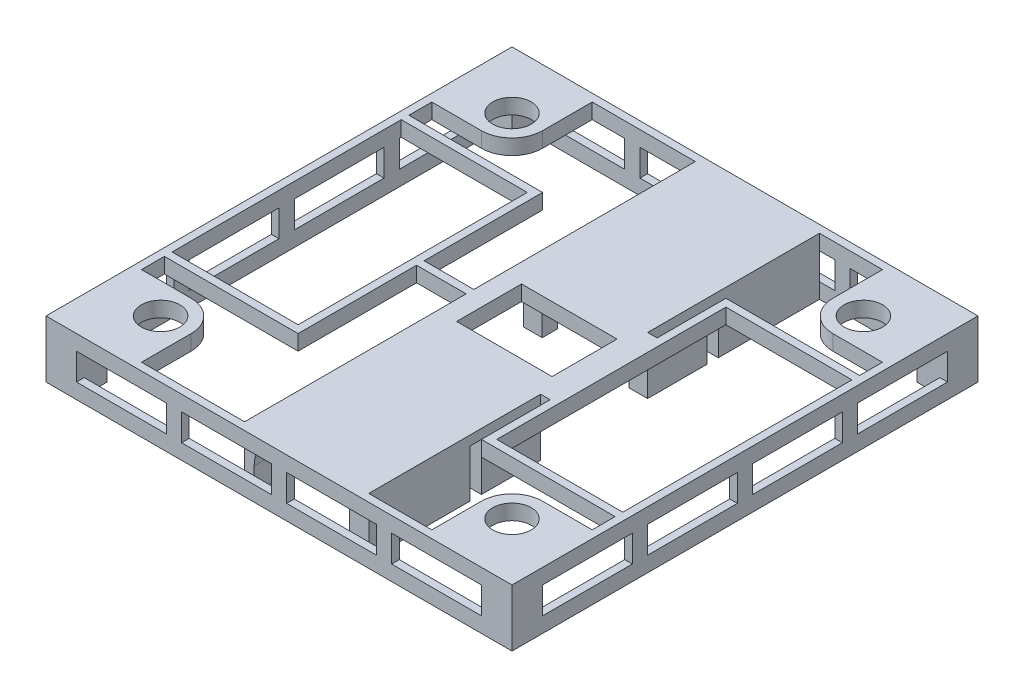
from build123d import *
from build123d.topology import SkipClean

# Parameters (mm, degrees)
SKETCH1_W                 = 122
SKETCH1_H                 = 122
SKETCH1_W_2               = 118
SKETCH1_H_2               = 118
BOSS_EXTRUDE2_DEPTH       = 15
CUT_EXTRUDE1_DEPTH        = 174.184872319
CUT_EXTRUDE1_DEPTH_BACK   = 174.184872319
SKETCH4_W                 = 106
SKETCH4_H                 = 7
CUT_EXTRUDE2_DEPTH        = 174.184872319
CUT_EXTRUDE2_DEPTH_BACK   = 174.184872319
SKETCH5_W                 = 106
SKETCH5_H                 = 7
SKETCH6_W                 = 6
SKETCH6_H                 = 6
BOSS_EXTRUDE3_DEPTH       = 15
SKETCH7_R                 = 8
SKETCH7_R_2               = 1.5
BOSS_EXTRUDE4_DEPTH       = 4
SKETCH8_R                 = 5.05
CUT_EXTRUDE3_DEPTH        = 4
SKETCH9_W                 = 2
SKETCH9_H                 = 7
BOSS_EXTRUDE5_DEPTH       = 122
CUT_EXTRUDE4_DEPTH        = 174.184872319
CUT_EXTRUDE4_DEPTH_BACK   = 174.184872319
SKETCH10_W                = 118
SKETCH10_H                = 61.219594365
SKETCH11_W                = 2
SKETCH11_H                = 7
BOSS_EXTRUDE6_DEPTH       = 122
SKETCH12_W                = 76
SKETCH12_H                = 118
CUT_EXTRUDE5_DEPTH        = 122
SKETCH13_W                = 5
SKETCH13_H                = 1
SKETCH13_W_2              = 1
SKETCH13_H_2              = 58
SKETCH13_W_3              = 15.5
SKETCH13_H_3              = 13
SKETCH13_W_4              = 37.5
SKETCH13_H_4              = 22.5
SKETCH13_H_5              = 4.5
SKETCH13_H_6              = 5
SKETCH13_H_7              = 8
BOSS_EXTRUDE7_DEPTH       = 4
SKETCH14_W                = 8
SKETCH14_H                = 4.5
BOSS_EXTRUDE8_DEPTH       = 15
BOSS_EXTRUDE11_DEPTH      = 4.5
SKETCH17_W                = 14.5
SKETCH17_H                = 4.5
BOSS_EXTRUDE12_DEPTH      = 2.5
SKETCH18_W                = 2
SKETCH18_H                = 45
CUT_EXTRUDE6_DEPTH        = 2
SKETCH19_W                = 22.5
SKETCH19_H                = 2.5
BOSS_EXTRUDE13_DEPTH      = 25
SKETCH21_W                = 5
SKETCH21_H                = 2.5
CUT_EXTRUDE7_DEPTH        = 12.5
SKETCH26_W                = 7.345444778
SKETCH26_H                = 18
CUT_EXTRUDE8_DEPTH        = 25
BOSS_EXTRUDE14_DEPTH      = 18
SKETCH29_R                = 8.5
CUT_EXTRUDE9_DEPTH        = 18
SKETCH30_W                = 22.5
SKETCH30_H                = 4.5
CUT_EXTRUDE10_DEPTH       = 6.35
SKETCH31_W                = 0.239140689
SKETCH31_H                = 0.334210842
CUT_EXTRUDE11_DEPTH       = 18
SKETCH32_W                = 8.5
SKETCH32_H                = 13.425892329
CUT_EXTRUDE12_DEPTH       = 18
SKETCH34_W                = 5
SKETCH34_H                = 2
CUT_EXTRUDE13_DEPTH       = 12.5
CUT_EXTRUDE14_DEPTH       = 6.35
SKETCH37_W                = 2
SKETCH37_H                = 2
BOSS_EXTRUDE15_DEPTH      = 4
BOSS_EXTRUDE16_DEPTH      = 4
SKETCH39_W                = 33
SKETCH39_H                = 2
CUT_EXTRUDE15_DEPTH       = 4
BOSS_EXTRUDE17_DEPTH      = 11
BOSS_EXTRUDE17_DEPTH_BACK = 4
SKETCH41_W                = 5
SKETCH41_H                = 26.5
SKETCH41_H_2              = 10
SKETCH42_W                = 32.5
SKETCH42_H                = 47
SKETCH42_W_2              = 5
SKETCH42_H_2              = 11
BOSS_EXTRUDE18_DEPTH      = 2.5
SKETCH46_W                = 5
SKETCH46_H                = 11
BOSS_EXTRUDE19_DEPTH      = 1.5
SKETCH47_W                = 2
SKETCH47_H                = 45
CUT_EXTRUDE16_DEPTH       = 1.5
SKETCH50_W                = 22.5
SKETCH50_H                = 5
BOSS_EXTRUDE21_DEPTH      = 6.15
CUT_EXTRUDE17_START       = -5
CUT_EXTRUDE17_DEPTH       = 5
SKETCH54_R                = 8.5
CUT_EXTRUDE18_DEPTH       = 17.4
CUT_EXTRUDE20_DEPTH       = 12.5
CUT_EXTRUDE21_DEPTH       = 173.986271132
CUT_EXTRUDE21_DEPTH_BACK  = 173.986271132
SKETCH58_W                = 22.5
SKETCH58_H                = 24
SKETCH62_W                = 32.5
SKETCH62_H                = 28
SKETCH62_W_2              = 22.5
SKETCH62_H_2              = 24
BOSS_EXTRUDE22_DEPTH      = 1.5
BOSS_EXTRUDE23_DEPTH      = 4
SKETCH64_W                = 25
SKETCH64_H                = 8.5
CUT_EXTRUDE22_DEPTH       = 4
SKETCH65_W                = 22.5
SKETCH65_H                = 3.5
BOSS_EXTRUDE24_DEPTH      = 4
CUT_EXTRUDE23_DEPTH       = 17.4
SKETCH68_W                = 5
SKETCH68_H                = 0.5
CUT_EXTRUDE24_DEPTH       = 12.5
CUT_EXTRUDE25_REACH       = 175.185
SKETCH69_W                = 0.1
SKETCH69_H                = 15.5


# Read off the part's stored shape, not the designer's step: Cut-Extrude17
with BuildPart() as part:
    # Sketch1 → Boss-Extrude2 (new body)
    with BuildSketch(Plane(origin=(0, 0, 0), x_dir=(1, 0, 0), z_dir=(0, 1, 0))):
        with Locations((61, 61)):
            Rectangle(SKETCH1_W, SKETCH1_H)
        with Locations((61, 61)):
            Rectangle(SKETCH1_W_2, SKETCH1_H_2, mode=Mode.SUBTRACT)
    extrude(amount=BOSS_EXTRUDE2_DEPTH)

    # Sketch4 → Cut-Extrude1 (cut, two sides: drawn at the far end of the back side and taken through both)
    with BuildSketch(Plane.XY.offset(-CUT_EXTRUDE1_DEPTH_BACK)):
        with Locations((61, 7.5)):
            Rectangle(SKETCH4_W, SKETCH4_H)
    extrude(amount=CUT_EXTRUDE1_DEPTH + CUT_EXTRUDE1_DEPTH_BACK, mode=Mode.SUBTRACT)

    # Sketch5 → Cut-Extrude2 (cut, two sides: drawn at the far end of the back side and taken through both)
    with BuildSketch(Plane.ZY.offset(-CUT_EXTRUDE2_DEPTH_BACK)):
        with Locations((-61, 7.5)):
            Rectangle(SKETCH5_W, SKETCH5_H)
    extrude(amount=CUT_EXTRUDE2_DEPTH + CUT_EXTRUDE2_DEPTH_BACK, mode=Mode.SUBTRACT)

    # Sketch6 → Boss-Extrude3 (add)
    with BuildSketch(Plane(origin=(0, 15, 0), x_dir=(1, 0, 0), z_dir=(0, 1, 0))):
        with Locations((5, 117)):
            Rectangle(SKETCH6_W, SKETCH6_H)
        with Locations((117, 117)):
            Rectangle(SKETCH6_W, SKETCH6_H)
        with Locations((117, 5)):
            Rectangle(SKETCH6_W, SKETCH6_H)
        with Locations((5, 5)):
            Rectangle(SKETCH6_W, SKETCH6_H)
    extrude(amount=-BOSS_EXTRUDE3_DEPTH)

    # Sketch7 → Boss-Extrude4 (add)
    # profile 1 of 8: a face of its own
    with BuildSketch(Plane(origin=(0, 15, 0), x_dir=(1, 0, 0), z_dir=(0, 1, 0))):
        with BuildLine():
            Line((2, 99), (15, 99))
            ThreePointArc((15, 99), (9.343145751, 112.656854249), (23, 107))
            Line((23, 107), (23, 120))
            Line((23, 120), (8, 120))
            Line((8, 120), (8, 114))
            Line((8, 114), (2, 114))
            Line((2, 114), (2, 99))
        make_face()
    # profile 2 of 8: a face of its own
    with BuildSketch(Plane(origin=(0, 15, 0), x_dir=(1, 0, 0), z_dir=(0, 1, 0))):
        with Locations((15, 107)):
            Circle(SKETCH7_R)
        with Locations(Location((15, 107, 0), (0, 0, 270))):
            Circle(SKETCH7_R_2, mode=Mode.SUBTRACT)
    # profile 3 of 8: a face of its own
    with BuildSketch(Plane(origin=(0, 15, 0), x_dir=(1, 0, 0), z_dir=(0, 1, 0))):
        with BuildLine():
            Line((114, 120), (99, 120))
            Line((99, 120), (99, 107))
            ThreePointArc((99, 107), (107, 115), (115, 107))
            ThreePointArc((115, 107), (112.656854249, 101.343145751), (107, 99))
            Line((107, 99), (120, 99))
            Line((120, 99), (120, 114))
            Line((120, 114), (114, 114))
            Line((114, 114), (114, 120))
        make_face()
    # profile 4 of 8: a face of its own
    with BuildSketch(Plane(origin=(0, 15, 0), x_dir=(1, 0, 0), z_dir=(0, 1, 0))):
        with Locations((107, 107)):
            Circle(SKETCH7_R)
        with Locations(Location((107, 107, 0), (0, 0, 270))):
            Circle(SKETCH7_R_2, mode=Mode.SUBTRACT)
    # profile 5 of 8: a face of its own
    with BuildSketch(Plane(origin=(0, 15, 0), x_dir=(1, 0, 0), z_dir=(0, 1, 0))):
        with Locations((107, 15)):
            Circle(SKETCH7_R)
        with Locations(Location((107, 15, 0), (0, 0, 270))):
            Circle(SKETCH7_R_2, mode=Mode.SUBTRACT)
    # profile 6 of 8: a face of its own
    with BuildSketch(Plane(origin=(0, 15, 0), x_dir=(1, 0, 0), z_dir=(0, 1, 0))):
        with BuildLine():
            Line((99, 15), (99, 2))
            Line((99, 2), (114, 2))
            Line((114, 2), (114, 8))
            Line((114, 8), (120, 8))
            Line((120, 8), (120, 23))
            Line((120, 23), (107, 23))
            ThreePointArc((107, 23), (112.656854249, 20.656854249), (115, 15))
            ThreePointArc((115, 15), (107, 7), (99, 15))
        make_face()
    # profile 7 of 8: a face of its own
    with BuildSketch(Plane(origin=(0, 15, 0), x_dir=(1, 0, 0), z_dir=(0, 1, 0))):
        with BuildLine():
            Line((15, 23), (2, 23))
            Line((2, 23), (2, 8))
            Line((2, 8), (8, 8))
            Line((8, 8), (8, 2))
            Line((8, 2), (23, 2))
            Line((23, 2), (23, 15))
            ThreePointArc((23, 15), (9.343145751, 9.343145751), (15, 23))
        make_face()
    # profile 8 of 8: a face of its own
    with BuildSketch(Plane(origin=(0, 15, 0), x_dir=(1, 0, 0), z_dir=(0, 1, 0))):
        with Locations((15, 15)):
            Circle(SKETCH7_R)
        with Locations(Location((15, 15, 0), (0, 0, 270))):
            Circle(SKETCH7_R_2, mode=Mode.SUBTRACT)
    extrude(amount=-BOSS_EXTRUDE4_DEPTH)

    # Sketch8 → Cut-Extrude3 (cut)
    with BuildSketch(Plane(origin=(0, 15, 0), x_dir=(1, 0, 0), z_dir=(0, 1, 0))):
        with Locations(Location((15, 15, 0), (0, 0, 270))):
            Circle(SKETCH8_R)
        with Locations(Location((107, 15, 0), (0, 0, 270))):
            Circle(SKETCH8_R)
        with Locations(Location((107, 107, 0), (0, 0, 270))):
            Circle(SKETCH8_R)
        with Locations(Location((15, 107, 0), (0, 0, 270))):
            Circle(SKETCH8_R)
    extrude(amount=-CUT_EXTRUDE3_DEPTH, mode=Mode.SUBTRACT)

    # Sketch9 → Boss-Extrude5 (add)
    with BuildSketch(Plane(origin=(122, 0, 0), x_dir=(0, 0, -1), z_dir=(1, 0, 0))):
        with Locations((32.5, 7.5)):
            Rectangle(SKETCH9_W, SKETCH9_H)
        with Locations((34.5, 7.5)):
            Rectangle(SKETCH9_W, SKETCH9_H)
        with Locations((62, 7.5)):
            Rectangle(SKETCH9_W, SKETCH9_H)
        with Locations((60, 7.5)):
            Rectangle(SKETCH9_W, SKETCH9_H)
        with Locations((89.5, 7.5)):
            Rectangle(SKETCH9_W, SKETCH9_H)
        with Locations((87.5, 7.5)):
            Rectangle(SKETCH9_W, SKETCH9_H)
    extrude(amount=-BOSS_EXTRUDE5_DEPTH)

    # Sketch10 → Cut-Extrude4 (cut, two sides: drawn at the far end of the back side and taken through both)
    with BuildSketch(Plane.XZ.offset(-CUT_EXTRUDE4_DEPTH_BACK)):
        with Locations((61, -62.109797183)):
            Rectangle(SKETCH10_W, SKETCH10_H)
    extrude(amount=CUT_EXTRUDE4_DEPTH + CUT_EXTRUDE4_DEPTH_BACK, mode=Mode.SUBTRACT)

    # Sketch11 → Boss-Extrude6 (add)
    with BuildSketch(Plane(origin=(0, 0, -122), x_dir=(-1, 0, 0), z_dir=(0, 0, -1))):
        with Locations((-89.5, 7.5)):
            Rectangle(SKETCH11_W, SKETCH11_H)
        with Locations((-87.5, 7.5)):
            Rectangle(SKETCH11_W, SKETCH11_H)
        with Locations((-60, 7.5)):
            Rectangle(SKETCH11_W, SKETCH11_H)
        with Locations((-62, 7.5)):
            Rectangle(SKETCH11_W, SKETCH11_H)
        with Locations((-32.5, 7.5)):
            Rectangle(SKETCH11_W, SKETCH11_H)
        with Locations((-34.5, 7.5)):
            Rectangle(SKETCH11_W, SKETCH11_H)
    extrude(amount=-BOSS_EXTRUDE6_DEPTH)

    # Sketch12 → Cut-Extrude5 (cut)
    with BuildSketch(Plane(origin=(0, 15, 0), x_dir=(1, 0, 0), z_dir=(0, 1, 0))):
        with Locations((61, 61)):
            Rectangle(SKETCH12_W, SKETCH12_H)
    extrude(amount=-CUT_EXTRUDE5_DEPTH, mode=Mode.SUBTRACT)

    # Sketch13 → Boss-Extrude7 (add)
    with BuildSketch(Plane(origin=(0, 15, 0), x_dir=(1, 0, 0), z_dir=(0, 1, 0))):
        Polygon((55, 61), (60, 61), (60, 62), (2, 62), (2, 61), align=None)
        Polygon((50, 60), (55, 60), (55, 61), (2, 61), (2, 60), align=None)
        with Locations((57.5, 60.5)):
            Rectangle(SKETCH13_W, SKETCH13_H)
        Polygon((55, 31), (55, 47), (55, 60), (50, 60), (50, 31), align=None)
        with Locations((60.5, 61.5)):
            Rectangle(SKETCH13_W_2, SKETCH13_H)
        with Locations((60.5, 60.5)):
            Rectangle(SKETCH13_W_2, SKETCH13_H)
        with Locations((61.5, 61.5)):
            Rectangle(SKETCH13_W_2, SKETCH13_H)
        with Locations((61.5, 60.5)):
            Rectangle(SKETCH13_W_2, SKETCH13_H)
        with Locations((60.5, 91)):
            Rectangle(SKETCH13_W_2, SKETCH13_H_2)
        with Locations((61.5, 91)):
            Rectangle(SKETCH13_W_2, SKETCH13_H_2)
        Polygon((62, 62), (62, 61), (77.5, 61), (82.5, 61), (120, 61), (120, 62), align=None)
        with Locations((69.75, 60.5)):
            Rectangle(SKETCH13_W_3, SKETCH13_H)
        with Locations((61.5, 53.5)):
            Rectangle(SKETCH13_W_2, SKETCH13_H_3)
        with Locations((60.5, 53.5)):
            Rectangle(SKETCH13_W_2, SKETCH13_H_3)
        with Locations((80, 60.5)):
            Rectangle(SKETCH13_W, SKETCH13_H)
        with Locations((101.25, 60.5)):
            Rectangle(SKETCH13_W_4, SKETCH13_H)
        Polygon((77.5, 60), (77.5, 47), (77.5, 31), (82.5, 31), (82.5, 60), align=None)
        with Locations((60.5, 35.75)):
            Rectangle(SKETCH13_W_2, SKETCH13_H_4)
        with Locations((61.5, 35.75)):
            Rectangle(SKETCH13_W_2, SKETCH13_H_4)
        with Locations((60.5, 22.25)):
            Rectangle(SKETCH13_W_2, SKETCH13_H_5)
        with Locations((61.5, 22.25)):
            Rectangle(SKETCH13_W_2, SKETCH13_H_5)
        Polygon((50, 15), (55, 15), (55, 20), (55, 24.5), (55, 28.5), (50, 28.5), align=None)
        with Locations((60.5, 17.5)):
            Rectangle(SKETCH13_W_2, SKETCH13_H_6)
        with Locations((61.5, 17.5)):
            Rectangle(SKETCH13_W_2, SKETCH13_H_6)
        with Locations((60.5, 12.5)):
            Rectangle(SKETCH13_W_2, SKETCH13_H_6)
        with Locations((61.5, 12.5)):
            Rectangle(SKETCH13_W_2, SKETCH13_H_6)
        with Locations((61.5, 6)):
            Rectangle(SKETCH13_W_2, SKETCH13_H_7)
        with Locations((60.5, 6)):
            Rectangle(SKETCH13_W_2, SKETCH13_H_7)
        Polygon((77.5, 24.5), (77.5, 15), (82.5, 15), (82.5, 28.5), (77.5, 28.5), align=None)
        with Locations((80, 8.5)):
            Rectangle(SKETCH13_W, SKETCH13_H_3)
        with Locations((52.5, 8.5)):
            Rectangle(SKETCH13_W, SKETCH13_H_3)
    extrude(amount=-BOSS_EXTRUDE7_DEPTH)

    # Sketch14 → Boss-Extrude8 (add)
    with BuildSketch(Plane(origin=(0, 15, 0), x_dir=(1, 0, 0), z_dir=(0, 1, 0))):
        Polygon((50, 2), (55, 2), (55, 47), (55, 49), (50, 49), align=None)
        Polygon((77.5, 2), (77.5, 47), (55, 47), (55, 49), (77.5, 49), (82.5, 49), (82.5, 2), align=None)
        with Locations((73.5, 22.25)):
            Rectangle(SKETCH14_W, SKETCH14_H)
    extrude(amount=-BOSS_EXTRUDE8_DEPTH)

    # Sketch16 → Boss-Extrude11 (add)
    with BuildSketch(Plane(origin=(0, 0, -24.5), x_dir=(-1, 0, 0), z_dir=(0, 0, -1))):
        with BuildLine():
            Line((-69.5, 12.5), (-69.5, 6.25))
            ThreePointArc((-69.5, 6.25), (-68.621320344, 8.371320344), (-66.5, 9.25))
            Line((-66.5, 9.25), (-66.196152423, 9.25))
            ThreePointArc((-66.196152423, 9.25), (-64, 11.446152423), (-61, 12.25))
            Line((-61, 12.25), (-61, 12.5))
            Line((-61, 12.5), (-69.5, 12.5))
        make_face()
        with BuildLine():
            ThreePointArc((-61, 12.25), (-56.757359313, 10.492640687), (-55, 6.25))
            Line((-55, 6.25), (-55, 12.5))
            Line((-55, 12.5), (-61, 12.5))
            Line((-61, 12.5), (-61, 12.25))
        make_face()
        with BuildLine():
            Line((-69.5, 6.25), (-69.5, 0))
            Line((-69.5, 0), (-55, 0))
            Line((-55, 0), (-55, 6.25))
            ThreePointArc((-55, 6.25), (-59.447085729, 0.454445042), (-66.196152423, 3.25))
            Line((-66.196152423, 3.25), (-66.5, 3.25))
            ThreePointArc((-66.5, 3.25), (-68.621320344, 4.128679656), (-69.5, 6.25))
        make_face()
    extrude(amount=-BOSS_EXTRUDE11_DEPTH)

    # Sketch17 → Boss-Extrude12 (add)
    with BuildSketch(Plane(origin=(0, 12.5, 0), x_dir=(1, 0, 0), z_dir=(0, 1, 0))):
        with Locations((62.25, 22.25)):
            Rectangle(SKETCH17_W, SKETCH17_H)
    extrude(amount=BOSS_EXTRUDE12_DEPTH)

    # Sketch18 → Cut-Extrude6 (cut)
    with BuildSketch(Plane.XZ.offset(-11)):
        with Locations((61, -24.5)):
            Rectangle(SKETCH18_W, SKETCH18_H)
    extrude(amount=-CUT_EXTRUDE6_DEPTH, mode=Mode.SUBTRACT)

    # Sketch19 → Boss-Extrude13 (add)
    with BuildSketch(Plane(origin=(55, 0, 0), x_dir=(0, 0, -1), z_dir=(1, 0, 0))):
        with Locations((13.25, 13.75)):
            Rectangle(SKETCH19_W, SKETCH19_H)
        with Locations((35.75, 13.75)):
            Rectangle(SKETCH19_W, SKETCH19_H)
    extrude(amount=BOSS_EXTRUDE13_DEPTH)

    # Sketch21 → Cut-Extrude7 (cut)
    with BuildSketch(Plane.XZ):
        with Locations((80, -29.75)):
            Rectangle(SKETCH21_W, SKETCH21_H)
        with Locations((52.5, -29.75)):
            Rectangle(SKETCH21_W, SKETCH21_H)
    extrude(amount=-CUT_EXTRUDE7_DEPTH, mode=Mode.SUBTRACT)

    # Sketch26 → Cut-Extrude8 (cut)
    with BuildSketch(Plane.XZ.offset(-12.5)):
        with Locations((51.327277611, -11)):
            Rectangle(SKETCH26_W, SKETCH26_H)
    extrude(amount=CUT_EXTRUDE8_DEPTH, mode=Mode.SUBTRACT)

    # Sketch27 → Boss-Extrude14 (add)
    with BuildSketch(Plane.XY.offset(-20)):
        with BuildLine():
            Line((50, 12.5), (50, 0))
            Line((50, 0), (55.239140689, 0))
            ThreePointArc((55.239140689, 0), (52.5, 6.25), (55.239140689, 12.5))
            Line((55.239140689, 12.5), (50, 12.5))
        make_face()
    extrude(amount=BOSS_EXTRUDE14_DEPTH)

    # Sketch29 → Cut-Extrude9 (cut)
    with SkipClean():  # the faces are left unmerged after this step: merging them gives an invalid solid
        with BuildSketch(Plane.XY.offset(-20)):
            with Locations((61, 6.25)):
                Circle(SKETCH29_R)
        extrude(amount=CUT_EXTRUDE9_DEPTH, mode=Mode.SUBTRACT)

    # Sketch30 → Cut-Extrude10 (cut)
    with SkipClean():  # the faces are left unmerged after this step: merging them gives an invalid solid
        with BuildSketch(Plane.XZ):
            with Locations((66.25, -22.25)):
                Rectangle(SKETCH30_W, SKETCH30_H)
        extrude(amount=-CUT_EXTRUDE10_DEPTH, mode=Mode.SUBTRACT)

    # Sketch31 → Cut-Extrude11 (cut)
    with SkipClean():  # the faces are left unmerged after this step: merging them gives an invalid solid
        with BuildSketch(Plane(origin=(0, 0, -20), x_dir=(-1, 0, 0), z_dir=(0, 0, -1))):
            with Locations((-55.119570345, 0.167105421)):
                Rectangle(SKETCH31_W, SKETCH31_H)
        extrude(amount=-CUT_EXTRUDE11_DEPTH, mode=Mode.SUBTRACT)

    # Sketch32 → Cut-Extrude12 (cut)
    with SkipClean():  # the faces are left unmerged after this step: merging them gives an invalid solid
        with BuildSketch(Plane.XY.offset(-2)):
            with Locations((56.75, -0.462946165)):
                Rectangle(SKETCH32_W, SKETCH32_H)
        extrude(amount=-CUT_EXTRUDE12_DEPTH, mode=Mode.SUBTRACT)

    # Sketch34 → Cut-Extrude13 (cut)
    with SkipClean():  # the faces are left unmerged after this step: merging them gives an invalid solid
        with BuildSketch(Plane.XZ):
            with Locations((52.5, -42)):
                Rectangle(SKETCH34_W, SKETCH34_H)
        extrude(amount=-CUT_EXTRUDE13_DEPTH, mode=Mode.SUBTRACT)

    # Sketch36 → Cut-Extrude14 (cut)
    with SkipClean():  # the faces are left unmerged after this step: merging them gives an invalid solid
        with BuildSketch(Plane(origin=(0, 15, 0), x_dir=(1, 0, 0), z_dir=(0, 1, 0))):
            Polygon((2, 61), (2, 60), (35, 60), (35, 62), (2, 62), align=None)
        extrude(amount=-CUT_EXTRUDE14_DEPTH, mode=Mode.SUBTRACT)

    # Sketch37 → Boss-Extrude15 (add)
    with SkipClean():  # the faces are left unmerged after this step: merging them gives an invalid solid
        with BuildSketch(Plane(origin=(0, 15, 0), x_dir=(1, 0, 0), z_dir=(0, 1, 0))):
            Polygon((35, 91), (35, 62), (37, 62), (37, 93), (2, 93), (2, 91), align=None)
            with Locations((36, 61)):
                Rectangle(SKETCH37_W, SKETCH37_H)
            Polygon((37, 60), (35, 60), (35, 31), (2, 31), (2, 29), (37, 29), align=None)
        extrude(amount=-BOSS_EXTRUDE15_DEPTH)

    # Sketch38 → Boss-Extrude16 (add)
    with SkipClean():  # the faces are left unmerged after this step: merging them gives an invalid solid
        with BuildSketch(Plane(origin=(0, 15, 0), x_dir=(1, 0, 0), z_dir=(0, 1, 0))):
            Polygon((87, 91), (87, 60), (87, 31), (120, 31), (120, 29), (85, 29), (85, 93), (120, 93), (120, 91), align=None)
        extrude(amount=-BOSS_EXTRUDE16_DEPTH)

    # Sketch39 → Cut-Extrude15 (cut)
    with SkipClean():  # the faces are left unmerged after this step: merging them gives an invalid solid
        with BuildSketch(Plane(origin=(0, 15, 0), x_dir=(1, 0, 0), z_dir=(0, 1, 0))):
            with Locations((103.5, 61)):
                Rectangle(SKETCH39_W, SKETCH39_H)
        extrude(amount=-CUT_EXTRUDE15_DEPTH, mode=Mode.SUBTRACT)

    # Sketch41 → Boss-Extrude17 (add, two sides: drawn at the far end of the back side and taken through both)
    with SkipClean():  # the faces are left unmerged after this step: merging them gives an invalid solid
        with BuildSketch(Plane(origin=(0, 11, 0), x_dir=(-1, 0, 0), z_dir=(0, -1, 0)).offset(-BOSS_EXTRUDE17_DEPTH_BACK)):
            Polygon((-77.5, 91), (-82.5, 91), (-82.5, 73), (-50, 73), (-50, 79), (-55, 79), (-55, 75), (-77.5, 75), align=None)
            with Locations((-80, 106.75)):
                Rectangle(SKETCH41_W, SKETCH41_H)
            with Locations((-52.5, 86)):
                Rectangle(SKETCH41_W, SKETCH41_H_2)
            with Locations((-52.5, 106.75)):
                Rectangle(SKETCH41_W, SKETCH41_H)
        extrude(amount=BOSS_EXTRUDE17_DEPTH + BOSS_EXTRUDE17_DEPTH_BACK)


with BuildPart() as boss_extrude17_piece_1:
    # of the separate pieces the step leaves, piece 1, a body of its own (boss_extrude17_pieces)
    add(part.part.solids().sort_by_distance((0, 0, -122))[0])



with BuildPart() as boss_extrude17_piece_2:
    # of the separate pieces the step leaves, piece 2, a body of its own (boss_extrude17_pieces)
    add(part.part.solids().sort_by_distance((50, 0, -91))[0])


with BuildPart() as boss_extrude17_piece_1_1:
    with SkipClean():  # the faces are left unmerged after this step: merging them gives an invalid solid
        add(boss_extrude17_piece_1.part)

        add(boss_extrude17_piece_2.part)  # Boss-Extrude18 merges Boss-Extrude17 piece 2
        # Sketch42 → Boss-Extrude18 (add)
        with BuildSketch(Plane(origin=(0, 15, 0), x_dir=(1, 0, 0), z_dir=(0, 1, 0))):
            with Locations((66.25, 96.5)):
                Rectangle(SKETCH42_W, SKETCH42_H)
            with Locations((80, 67.5)):
                Rectangle(SKETCH42_W_2, SKETCH42_H_2)
            with Locations((52.5, 67.5)):
                Rectangle(SKETCH42_W_2, SKETCH42_H_2)
        extrude(amount=-BOSS_EXTRUDE18_DEPTH)

    # Sketch46 → Boss-Extrude19 (add)
    with SkipClean():  # the faces are left unmerged after this step: merging them gives an invalid solid
        with BuildSketch(Plane.XZ.offset(-12.5)):
            with Locations((80, -67.5)):
                Rectangle(SKETCH46_W, SKETCH46_H)
            with Locations((52.5, -67.5)):
                Rectangle(SKETCH46_W, SKETCH46_H)
        extrude(amount=BOSS_EXTRUDE19_DEPTH)

    # Sketch47 → Cut-Extrude16 (cut)
    with SkipClean():  # the faces are left unmerged after this step: merging them gives an invalid solid
        with BuildSketch(Plane.XZ.offset(-11)):
            with Locations((61, -97.5)):
                Rectangle(SKETCH47_W, SKETCH47_H)
        extrude(amount=-CUT_EXTRUDE16_DEPTH, mode=Mode.SUBTRACT)

    # Sketch50 → Boss-Extrude21 (add)
    with SkipClean():  # the faces are left unmerged after this step: merging them gives an invalid solid
        with BuildSketch(Plane.XZ.offset(-12.5)):
            with Locations((66.25, -100.1)):
                Rectangle(SKETCH50_W, SKETCH50_H)
        extrude(amount=BOSS_EXTRUDE21_DEPTH)

    # Cut-Extrude17 outline → Cut-Extrude17 (cut)
    with SkipClean():  # the faces are left unmerged after this step: merging them gives an invalid solid
        with BuildSketch(Plane.XY.offset(-97.6).offset(CUT_EXTRUDE17_START)):
            with BuildLine():
                Line((55, 6.35), (69.49833287, 6.35))
                ThreePointArc((69.49833287, 6.35), (68.585665361, 8.406385865), (66.5, 9.25))
                Line((66.5, 9.25), (66.197114584, 9.25))
                ThreePointArc((66.197114584, 9.25), (59.495454804, 12.059160331), (55, 6.35))
            make_face()
        extrude(amount=CUT_EXTRUDE17_DEPTH, mode=Mode.SUBTRACT)

    # Sketch54 → Cut-Extrude18 (cut)
    with SkipClean():  # the faces are left unmerged after this step: merging them gives an invalid solid
        with BuildSketch(Plane(origin=(0, 0, -102.6), x_dir=(-1, 0, 0), z_dir=(0, 0, -1))):
            with Locations((-61, 6.25)):
                Circle(SKETCH54_R)
        extrude(amount=CUT_EXTRUDE18_DEPTH, mode=Mode.SUBTRACT)

    # Sketch57 → Cut-Extrude20 (cut)
    with SkipClean():  # the faces are left unmerged after this step: merging them gives an invalid solid
        with BuildSketch(Plane.XZ):
            Polygon((82.5, -49), (82.5, -47), (77.5, -47), (55, -47), (50, -47), (50, -49), align=None)
            Polygon((82.5, -73), (82.5, -49), (50, -49), (50, -75), (82.5, -75), align=None)
        extrude(amount=-CUT_EXTRUDE20_DEPTH, mode=Mode.SUBTRACT)

    # Sketch58 → Cut-Extrude21 (cut, two sides: drawn at the far end of the back side and taken through both)
    with SkipClean():  # the faces are left unmerged after this step: merging them gives an invalid solid
        with BuildSketch(Plane.XZ.offset(-12.5).offset(-CUT_EXTRUDE21_DEPTH_BACK)):
            with Locations((66.25, -61)):
                Rectangle(SKETCH58_W, SKETCH58_H)
        extrude(amount=CUT_EXTRUDE21_DEPTH + CUT_EXTRUDE21_DEPTH_BACK, mode=Mode.SUBTRACT)

    # Sketch62 → Boss-Extrude22 (add)
    with SkipClean():  # the faces are left unmerged after this step: merging them gives an invalid solid
        with BuildSketch(Plane.XZ.offset(-12.5)):
            with Locations((66.25, -61)):
                Rectangle(SKETCH62_W, SKETCH62_H)
            with Locations((66.25, -61)):
                Rectangle(SKETCH62_W_2, SKETCH62_H_2, mode=Mode.SUBTRACT)
        extrude(amount=BOSS_EXTRUDE22_DEPTH)

    # Sketch63 → Boss-Extrude23 (add)
    with SkipClean():  # the faces are left unmerged after this step: merging them gives an invalid solid
        with BuildSketch(Plane(origin=(0, 11, 0), x_dir=(-1, 0, 0), z_dir=(0, -1, 0))):
            Polygon((-82.5, 47), (-85, 47), (-82.5, 75), align=None)
            Polygon((-82.5, 75), (-85, 75), (-85, 47), align=None)
        extrude(amount=-BOSS_EXTRUDE23_DEPTH)

    # Sketch64 → Cut-Extrude22 (cut)
    with SkipClean():  # the faces are left unmerged after this step: merging them gives an invalid solid
        with BuildSketch(Plane.XZ.offset(-11)):
            with Locations((67.5, -56.75)):
                Rectangle(SKETCH64_W, SKETCH64_H)
            with Locations((67.5, -65.25)):
                Rectangle(SKETCH64_W, SKETCH64_H)
        extrude(amount=-CUT_EXTRUDE22_DEPTH, mode=Mode.SUBTRACT)

    # Sketch65 → Boss-Extrude24 (add)
    with SkipClean():  # the faces are left unmerged after this step: merging them gives an invalid solid
        with BuildSketch(Plane(origin=(0, 11, 0), x_dir=(-1, 0, 0), z_dir=(0, -1, 0))):
            with Locations((-66.25, 50.75)):
                Rectangle(SKETCH65_W, SKETCH65_H)
            with Locations((-66.25, 71.25)):
                Rectangle(SKETCH65_W, SKETCH65_H)
        extrude(amount=-BOSS_EXTRUDE24_DEPTH)

    # Sketch67 → Cut-Extrude23 (cut)
    with SkipClean():  # the faces are left unmerged after this step: merging them gives an invalid solid
        with BuildSketch(Plane(origin=(0, 0, -102.6), x_dir=(-1, 0, 0), z_dir=(0, 0, -1))):
            with BuildLine():
                Line((-52.5, -3.563188124), (-52.5, 6.25))
                ThreePointArc((-52.5, 6.25), (-53.149840766, 2.990398797), (-55, 0.229202711))
                ThreePointArc((-55, 0.229202711), (-55.813781188, -0.484473583), (-56.711659781, -1.088946666))
                Line((-56.711659781, -1.088946666), (-52.5, -3.563188124))
            make_face()
        extrude(amount=CUT_EXTRUDE23_DEPTH, mode=Mode.SUBTRACT)

    # Sketch68 → Cut-Extrude24 (cut)
    with SkipClean():  # the faces are left unmerged after this step: merging them gives an invalid solid
        with BuildSketch(Plane.XZ):
            with Locations((80, -31.25)):
                Rectangle(SKETCH68_W, SKETCH68_H)
            with Locations((52.5, -31.25)):
                Rectangle(SKETCH68_W, SKETCH68_H)
            with Locations((52.5, -90.75)):
                Rectangle(SKETCH68_W, SKETCH68_H)
            with Locations((80, -90.75)):
                Rectangle(SKETCH68_W, SKETCH68_H)
        extrude(amount=-CUT_EXTRUDE24_DEPTH, mode=Mode.SUBTRACT)

    # Cut-Extrude25: up to this face of the body (flat: up to its plane)
    cut_extrude25_end = Plane(boss_extrude17_piece_1_1.part.faces().sort_by_distance((66.162540491, 12.5, -35.247454882))[0])
    # Sketch69 → Cut-Extrude25 (cut, up to the picked face)
    with BuildSketch(Plane(origin=(0, 0, 0), x_dir=(-1, 0, 0), z_dir=(0, -1, 0)), mode=Mode.PRIVATE) as cut_extrude25_sk1:
        with Locations((-77.55, 39.25)):
            Rectangle(SKETCH69_W, SKETCH69_H)
    cut_extrude25_tool1 = split(extrude(cut_extrude25_sk1.sketch, amount=-CUT_EXTRUDE25_REACH, mode=Mode.PRIVATE), bisect_by=cut_extrude25_end, keep=Keep.BOTH, mode=Mode.PRIVATE)
    # Sketch69 → Cut-Extrude25 (cut, up to the picked face)
    with BuildSketch(Plane(origin=(0, 0, 0), x_dir=(-1, 0, 0), z_dir=(0, -1, 0)), mode=Mode.PRIVATE) as cut_extrude25_sk2:
        with Locations((-54.95, 39.25)):
            Rectangle(SKETCH69_W, SKETCH69_H)
    cut_extrude25_tool2 = split(extrude(cut_extrude25_sk2.sketch, amount=-CUT_EXTRUDE25_REACH, mode=Mode.PRIVATE), bisect_by=cut_extrude25_end, keep=Keep.BOTH, mode=Mode.PRIVATE)
    # Sketch69 → Cut-Extrude25 (cut, up to the picked face)
    with BuildSketch(Plane(origin=(0, 0, 0), x_dir=(-1, 0, 0), z_dir=(0, -1, 0)), mode=Mode.PRIVATE) as cut_extrude25_sk3:
        with Locations((-54.95, 82.75)):
            Rectangle(SKETCH69_W, SKETCH69_H)
    cut_extrude25_tool3 = split(extrude(cut_extrude25_sk3.sketch, amount=-CUT_EXTRUDE25_REACH, mode=Mode.PRIVATE), bisect_by=cut_extrude25_end, keep=Keep.BOTH, mode=Mode.PRIVATE)
    # Sketch69 → Cut-Extrude25 (cut, up to the picked face)
    with BuildSketch(Plane(origin=(0, 0, 0), x_dir=(-1, 0, 0), z_dir=(0, -1, 0)), mode=Mode.PRIVATE) as cut_extrude25_sk4:
        with Locations((-77.55, 82.75)):
            Rectangle(SKETCH69_W, SKETCH69_H)
    cut_extrude25_tool4 = split(extrude(cut_extrude25_sk4.sketch, amount=-CUT_EXTRUDE25_REACH, mode=Mode.PRIVATE), bisect_by=cut_extrude25_end, keep=Keep.BOTH, mode=Mode.PRIVATE)
    add(cut_extrude25_tool1.solids().sort_by(Axis((77.55, 0, -39.25), (0, 1, 0)))[0], mode=Mode.SUBTRACT)
    add(cut_extrude25_tool2.solids().sort_by(Axis((54.95, 0, -39.25), (0, 1, 0)))[0], mode=Mode.SUBTRACT)
    add(cut_extrude25_tool3.solids().sort_by(Axis((54.95, 0, -82.75), (0, 1, 0)))[0], mode=Mode.SUBTRACT)
    add(cut_extrude25_tool4.solids().sort_by(Axis((77.55, 0, -82.75), (0, 1, 0)))[0], mode=Mode.SUBTRACT)


solid = boss_extrude17_piece_1_1.part
